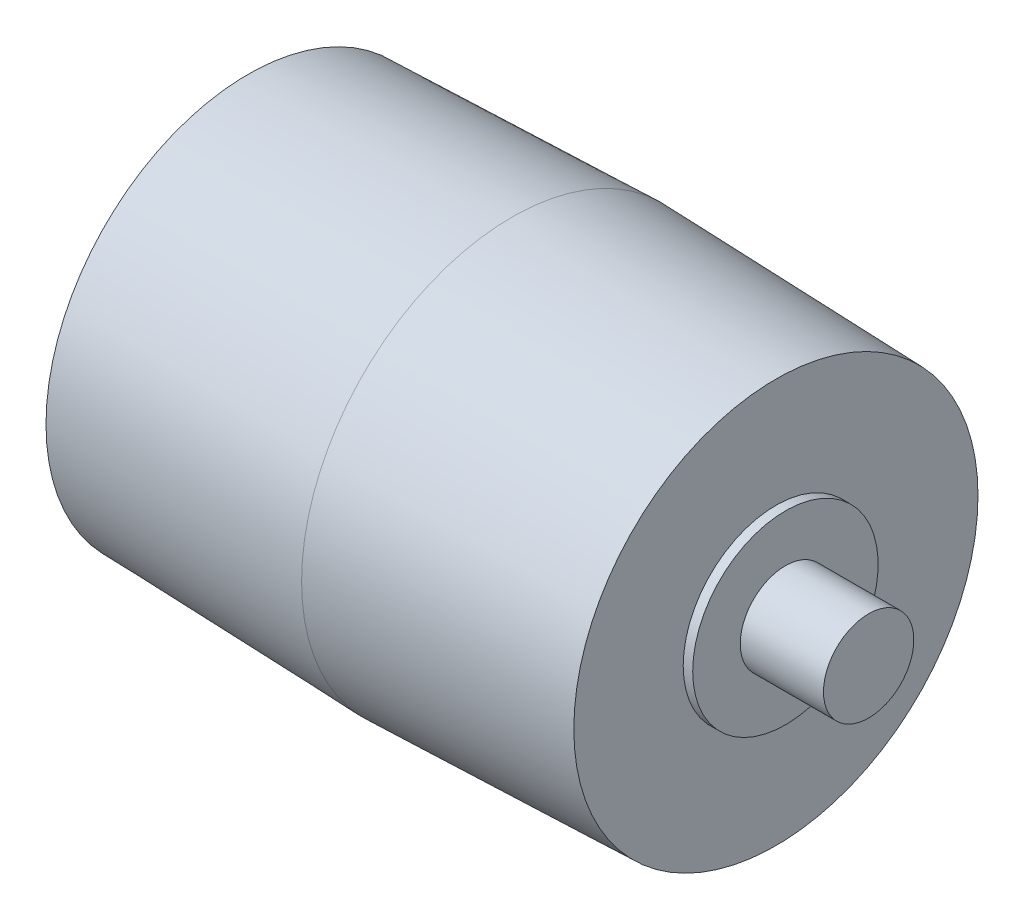
from build123d import *


with BuildPart() as part:
    # Sketch1 → Revolve1 (revolve)
    with BuildSketch(Plane.XY):
        Polygon((-9.525, 0), (-9.525, 1.2065), (-7.3025, 1.2065), (-7.3025, 2.4765), (-7.0485, 2.4765), (-7.0485, 5.3975), (0, 5.61975), (7.0485, 5.3975), (7.0485, 2.4765), (7.3025, 2.4765), (7.3025, 1.2065), (9.525, 1.2065), (9.525, 0), align=None)
    revolve(axis=Axis((-9.525, 0, 0), (1, 0, 0)))


solid = part.part
